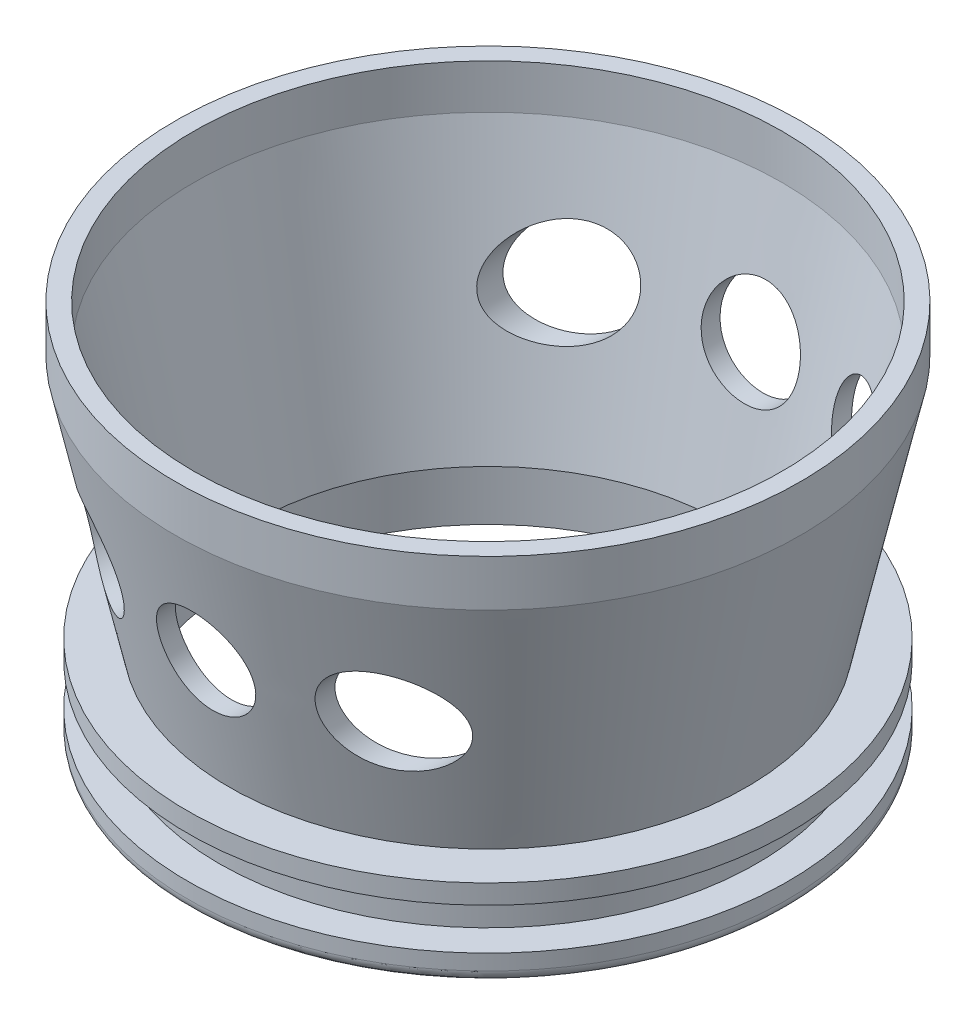
from build123d import *

# Parameters (mm, degrees)
FILLET1_R          = 0.762
SKETCH2_R          = 3.175
CUT_EXTRUDE1_DEPTH = 21.59


# Read off the part's stored shape, not the designer's step: Shell1
with BuildPart() as part:
    # Sketch1 → Revolve1 (revolve)
    with BuildSketch(Plane.XY, mode=Mode.PRIVATE) as revolve1_sk:
        Polygon((19.6723, 0), (19.6723, 1.778), (17.6403, 1.778), (17.6403, 4.4958), (19.6723, 4.4958), (19.6723, 5.7658), (16.9545, 5.7658), (20.4978, 21.844), (20.4978, 24.892), (0, 24.892), (0, 0), align=None)
    revolve(revolve1_sk.sketch.rotate(Axis((0, 0, 0), (0, 1, 0)), 90), axis=Axis((0, 0, 0), (0, 1, 0)))

    # Fillet1
    fillet1_edges = [part.edges().sort_by_distance(p)[0] for p in [
        (0, 0, 19.6723),
    ]]
    fillet(fillet1_edges, radius=FILLET1_R)

    # Shell1 outline → Shell1 (revolve, cut)
    with BuildSketch(Plane.XY):
        Polygon((16.4465, 4.572), (15.468965439, 4.572), (19.304, 21.973984782), (19.304, 24.892), (0, 24.892), (0, 0), (18.4785, 0), (18.4785, 0.5842), (16.4465, 0.5842), align=None)
    revolve(axis=Axis((0, 0, 0), (0, 1, 0)), mode=Mode.SUBTRACT)

    # Sketch2 → Cut-Extrude1 (cut, symmetric)
    with BuildSketch(Plane.XY):
        with Locations(Location((0, 13.843, 0), (0, 0, 270.000000005))):
            Circle(SKETCH2_R)
        with Locations(Location((-9.533032066, 13.843, 0), (0, 0, 215.10740663))):
            Circle(SKETCH2_R)
        with Locations(Location((9.525, 13.843, 0), (0, 0, 247.150680843))):
            Circle(SKETCH2_R)
    extrude(amount=CUT_EXTRUDE1_DEPTH, both=True, mode=Mode.SUBTRACT)


solid = part.part
